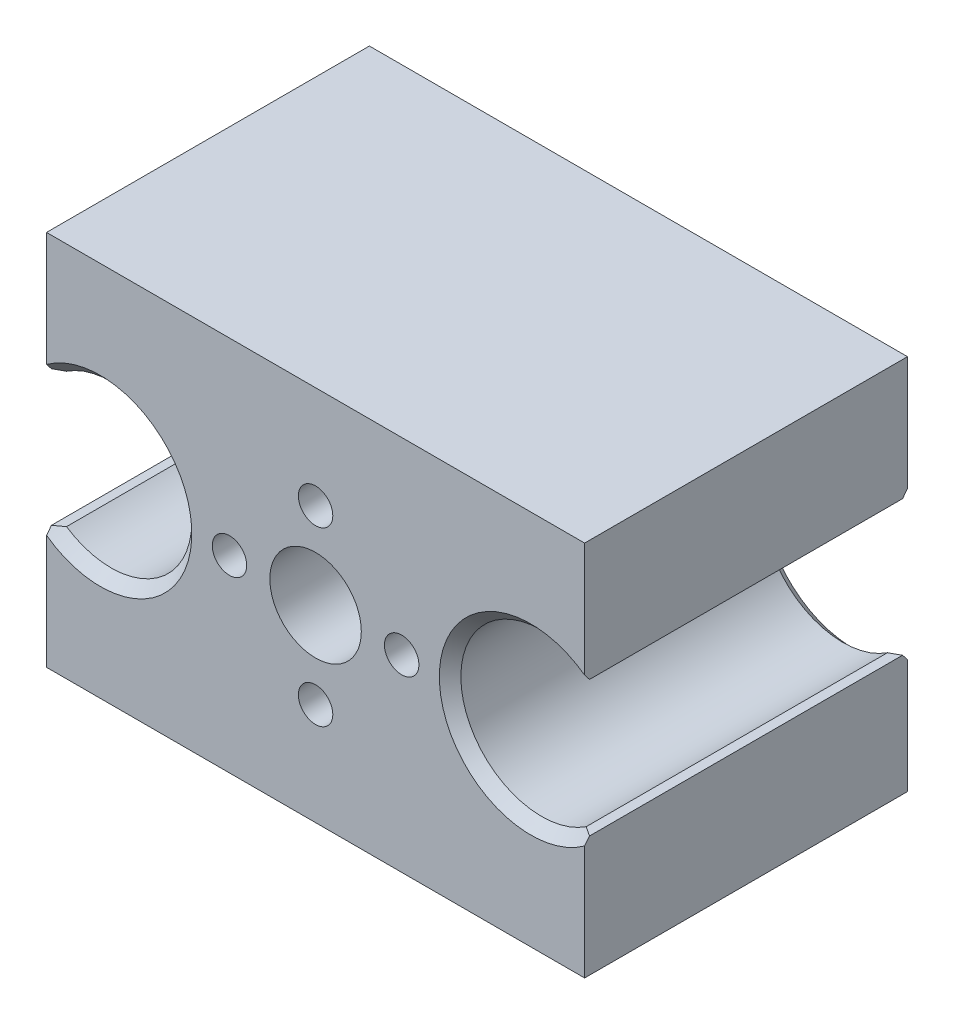
from build123d import *

# Parameters (mm, degrees)
SKETCH_1_W        = 50
SKETCH_1_H        = 35
EXTRUDE_1_DEPTH   = 30
HOLE_WIZARD_341_D = 8.5
HOLE_WIZARD_446_D = 3.2
HOLE_WIZARD_600_D = 15
CHAMFER_1_SIZE    = 1
CHAMFER_1_SIZE_2  = 0.708203932


with BuildPart() as part:
    # 草图1 → 凸台-拉伸1 (new body)
    with BuildSketch(Plane.XY):
        Rectangle(SKETCH_1_W, SKETCH_1_H)
    extrude(amount=EXTRUDE_1_DEPTH)

    # Hole Wizard 341 (through all)
    with Locations(Plane.XY.offset(30)):
        with Locations((0, 0)):
            Hole(HOLE_WIZARD_341_D / 2)

    # Hole Wizard 446 (through all)
    with Locations(Plane.XY.offset(30)):
        with Locations((8, 0), (0, 8), (-8, 0), (0, -8)):
            Hole(HOLE_WIZARD_446_D / 2)

    # Hole Wizard 600 (through all)
    with Locations(Plane.XY.offset(30)):
        with Locations((20, 0), (-20, 0)):
            Hole(HOLE_WIZARD_600_D / 2)

    # 倒角1
    # the kernel refuses this chamfer: 1, 0.708203932 mm, written as the material it takes off along each edge
    with BuildSketch(Plane(origin=(-20, 0, 0), x_dir=(-0.8790200859122482, 0.4767847402789059, 0), z_dir=(-0.4767847402789059, -0.8790200859122482, 0))) as chamfer_1_piece_1:
        Polygon((7.5, -CHAMFER_1_SIZE), (7.5 + CHAMFER_1_SIZE, 0), (7.5, 0), align=None)
    revolve(axis=Axis((-20, 0, 0), (0, 0, -1)), revolution_arc=303.048763938, mode=Mode.SUBTRACT)
    with BuildSketch(Plane(origin=(-20, 0, 30), x_dir=(-0.879020085912248, 0.47678474027890627, 0), z_dir=(-0.47678474027890627, -0.879020085912248, 0))) as chamfer_1_piece_2:
        Polygon((7.5 + CHAMFER_1_SIZE, 0), (7.5, CHAMFER_1_SIZE), (7.5, 0), align=None)
    revolve(axis=Axis((-20, 0, 30), (0, 0, -1)), revolution_arc=303.048763938, mode=Mode.SUBTRACT)
    with BuildSketch(Plane(origin=(20, 0, 30), x_dir=(0.879020085912248, -0.4767847402789061, 0), z_dir=(0.4767847402789061, 0.879020085912248, 0))) as chamfer_1_piece_3:
        Polygon((7.5 + CHAMFER_1_SIZE, 0), (7.5, CHAMFER_1_SIZE), (7.5, 0), align=None)
    revolve(axis=Axis((20, 0, 30), (0, 0, -1)), revolution_arc=303.048763938, mode=Mode.SUBTRACT)
    with BuildSketch(Plane(origin=(20, 0, 0), x_dir=(0.8790200859122481, 0.476784740278906, 0), z_dir=(0.476784740278906, -0.8790200859122481, 0))) as chamfer_1_piece_4:
        Polygon((7.5, CHAMFER_1_SIZE), (7.5 + CHAMFER_1_SIZE, 0), (7.5, 0), align=None)
    revolve(axis=Axis((20, 0, 0), (0, 0, 1)), revolution_arc=303.048763938, mode=Mode.SUBTRACT)
    with BuildSketch(Plane(origin=(-25, 5.590169944, 32.778051389), x_dir=(0.7914486393779661, 0.611235675682274, 0), z_dir=(0, 0, -1)), Plane(origin=(25, -5.590169944, 32.778051389), x_dir=(-0.7914486393779661, -0.611235675682274, 0), z_dir=(0, 0, -1))) as chamfer_1_piece_5:
        with BuildLine():
            Line((1.080663788, 0), (CHAMFER_1_SIZE_2 * 0.611235676113, -CHAMFER_1_SIZE_2 * 0.791448639936))
            Line((CHAMFER_1_SIZE_2 * 0.611235676113, -CHAMFER_1_SIZE_2 * 0.791448639936), (0, 0))
            ThreePointArc((0, 0), (0.555522087, -0.019473843), (1.080663788, 0))
        make_face()
    extrude(amount=35.556102778, mode=Mode.SUBTRACT)
    with BuildSketch(Plane(origin=(-25, -5.590169944, 32.778051389), x_dir=(0.7914486393779665, -0.6112356756822735, 0), z_dir=(0, 0, -1))) as chamfer_1_piece_6:
        with BuildLine():
            Line((1.080663788, 0), (CHAMFER_1_SIZE_2 * 0.611235676113, CHAMFER_1_SIZE_2 * 0.791448639936))
            Line((CHAMFER_1_SIZE_2 * 0.611235676113, CHAMFER_1_SIZE_2 * 0.791448639936), (0, 0))
            ThreePointArc((0, 0), (0.555522087, 0.019473843), (1.080663788, 0))
        make_face()
    extrude(amount=35.556102778, mode=Mode.SUBTRACT)
    with BuildSketch(Plane(origin=(25, 5.590169944, 32.778051389), x_dir=(0, 1, 0), z_dir=(0, 0, -1))) as chamfer_1_piece_7:
        with BuildLine():
            Line((CHAMFER_1_SIZE_2, 0), (0.660540261, -0.855289885))
            ThreePointArc((0.660540261, -0.855289885), (0.354967464, -0.427764092), (0, 0))
            Line((0, 0), (CHAMFER_1_SIZE_2, 0))
        make_face()
    extrude(amount=35.556102778, mode=Mode.SUBTRACT)


solid = part.part
